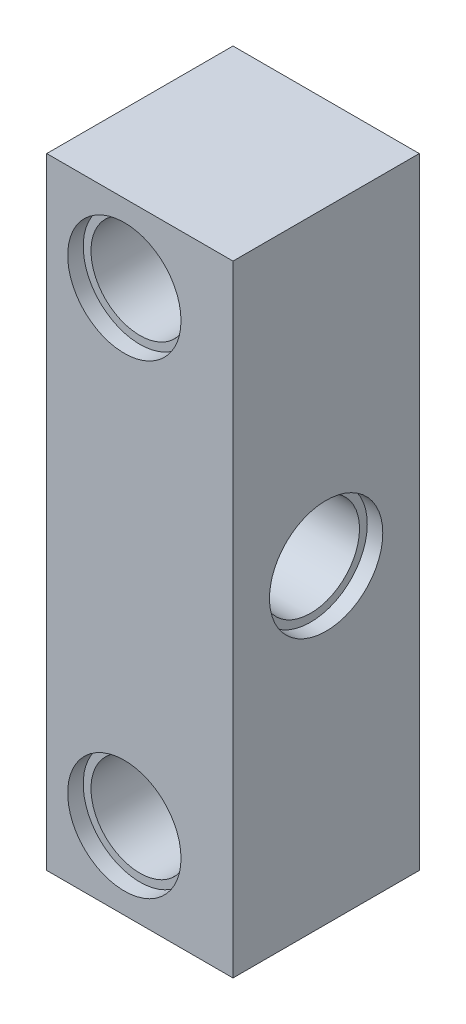
from build123d import *

# Parameters (mm, degrees)
ESQUISSE1_W                  = 12
ESQUISSE1_H                  = 40
BOSS_EXTRU_1_DEPTH           = 12
ENL_V_MAT_EXTRU_1_DEPTH      = 44.451121965
ENL_V_MAT_EXTRU_1_DEPTH_BACK = 44.451121965
ESQUISSE3_R                  = 3.15
ENL_V_MAT_EXTRU_2_DEPTH      = 44.451121965
ENL_V_MAT_EXTRU_2_DEPTH_BACK = 44.451121965
ESQUISSE4_R                  = 3.15
ESQUISSE5_R                  = 3.65
ENL_V_MAT_EXTRU_3_DEPTH      = 1
ESQUISSE6_R                  = 3.65
ENL_V_MAT_EXTRU_4_DEPTH      = 1


with BuildPart() as part:
    # Esquisse1 → Boss.-Extru.1 (new body)
    with BuildSketch(Plane.XY):
        with Locations((6, 20)):
            Rectangle(ESQUISSE1_W, ESQUISSE1_H)
    extrude(amount=BOSS_EXTRU_1_DEPTH)

    # Esquisse3 → Enlèv. mat.-Extru.1 (cut, two sides: drawn at the far end of the back side and taken through both)
    with BuildSketch(Plane.XY.offset(12).offset(-ENL_V_MAT_EXTRU_1_DEPTH_BACK)):
        with Locations((5, 5)):
            Circle(ESQUISSE3_R)
        with Locations((5, 35)):
            Circle(ESQUISSE3_R)
    extrude(amount=ENL_V_MAT_EXTRU_1_DEPTH + ENL_V_MAT_EXTRU_1_DEPTH_BACK, mode=Mode.SUBTRACT)

    # Esquisse4 → Enlèv. mat.-Extru.2 (cut, two sides: drawn at the far end of the back side and taken through both)
    with BuildSketch(Plane(origin=(12, 0, 0), x_dir=(0, 0, -1), z_dir=(1, 0, 0)).offset(-ENL_V_MAT_EXTRU_2_DEPTH_BACK)):
        with Locations((-6, 20)):
            Circle(ESQUISSE4_R)
    extrude(amount=ENL_V_MAT_EXTRU_2_DEPTH + ENL_V_MAT_EXTRU_2_DEPTH_BACK, mode=Mode.SUBTRACT)

    # Esquisse5 → Enlèv. mat.-Extru.3 (cut)
    with BuildSketch(Plane.XY.offset(12)):
        with Locations((5, 35)):
            Circle(ESQUISSE5_R)
        with Locations((5, 5)):
            Circle(ESQUISSE5_R)
    extrude(amount=-ENL_V_MAT_EXTRU_3_DEPTH, mode=Mode.SUBTRACT)

    # Esquisse6 → Enlèv. mat.-Extru.4 (cut)
    with BuildSketch(Plane(origin=(12, 0, 0), x_dir=(0, 0, -1), z_dir=(1, 0, 0))):
        with Locations((-6, 20)):
            Circle(ESQUISSE6_R)
    extrude(amount=-ENL_V_MAT_EXTRU_4_DEPTH, mode=Mode.SUBTRACT)


solid = part.part
